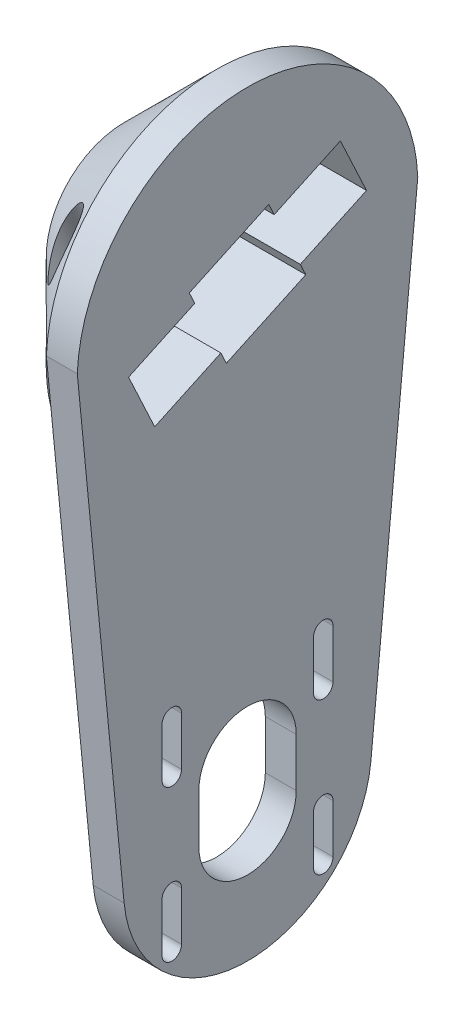
from build123d import *

# Parameters (mm, degrees)
BOSS_EXTRUDE1_DEPTH = 6.35
SKETCH20_R          = 35
BOSS_EXTRUDE5_DEPTH = 19.05
CUT_EXTRUDE14_DEPTH = 128.996314535
CHAMFER1_SIZE       = 19.05
SKETCH22_R          = 3.175
CUT_EXTRUDE15_DEPTH = 135.156064825
SKETCH24_R          = 5
CUT_EXTRUDE16_DEPTH = 140.018309755
SKETCH25_R          = 2.38125
CUT_EXTRUDE17_DEPTH = 10
CUT_EXTRUDE18_DEPTH = 10


with BuildPart() as part:
    # Sketch1 → Boss-Extrude1 (new body)
    with BuildSketch(Plane(origin=(0, 0, 0), x_dir=(0, 0, -1), z_dir=(1, 0, 0))):
        with BuildLine():
            Line((-34.968464441, 1.48542743), (-25.35, -97.464164516))
            ThreePointArc((-25.35, -97.464164516), (0, -120.469483831), (25.35, -97.464164516))
            Line((25.35, -97.464164516), (34.968464441, 1.48542743))
            ThreePointArc((34.968464441, 1.48542743), (0, 35), (-34.968464441, 1.48542743))
        make_face()
        Polygon((4.353205728, 11.960334439), (-11.960334439, 4.353205728), (-4.353205728, -11.960334439), (11.960334439, -4.353205728), align=None, mode=Mode.SUBTRACT)
    extrude(amount=BOSS_EXTRUDE1_DEPTH)

    # Sketch20 → Boss-Extrude5 (add)
    with BuildSketch(Plane(origin=(6.35, 0, 0), x_dir=(0, 0, -1), z_dir=(1, 0, 0))):
        with Locations(Location((0, 0, 0), (0, 0, 177.567591624))):
            Circle(SKETCH20_R)
    extrude(amount=BOSS_EXTRUDE5_DEPTH)

    # Sketch21 → Cut-Extrude14 (cut, through all)
    with BuildSketch(Plane.ZY):
        Polygon((-19.067760927, 15.897892729), (-24.435012851, 4.387783834), (-10.840396045, -1.951490092), (-5.473144121, 9.558618803), align=None)
        Polygon((-11.960334439, -4.353205728), (-4.353205728, 11.960334439), (11.960334439, 4.353205728), (4.353205728, -11.960334439), align=None)
        Polygon((10.840396045, 1.951490092), (5.473144121, -9.558618803), (19.067760927, -15.897892729), (24.435012851, -4.387783834), align=None)
    extrude(amount=-CUT_EXTRUDE14_DEPTH, mode=Mode.SUBTRACT)

    # Chamfer1
    # the kernel refuses this chamfer: 19.05 mm, written as the material it takes off along each edge
    with BuildSketch(Plane(origin=(25.4, 0, 0), x_dir=(0, 0.042440783710504346, 0.9990989840241247), z_dir=(0, 0.9990989840241247, -0.042440783710504346))) as chamfer1_piece_1:
        Polygon((35, -CHAMFER1_SIZE), (35 - CHAMFER1_SIZE, 0), (35, 0), align=None)
    revolve(axis=Axis((25.4, 0, 0), (1, 0, 0)), mode=Mode.SUBTRACT)

    # Sketch22 → Cut-Extrude15 (cut, through all)
    with BuildSketch(Plane(origin=(0, 5.755054448, 2.683625962), x_dir=(-1, 0, 0), z_dir=(0, -0.9063077870366495, -0.4226182617407006))):
        with Locations(Location((-13.4, -16.5, 0), (0, 0, 90))):
            Circle(SKETCH22_R)
    cut_extrude15 = extrude(amount=-CUT_EXTRUDE15_DEPTH, mode=Mode.SUBTRACT)

    # Sketch24 → Cut-Extrude16 (cut, through all)
    with BuildSketch(Plane(origin=(0, 10.286593383, 4.796717271), x_dir=(-1, 0, 0), z_dir=(0, -0.9063077870366495, -0.4226182617407006))):
        with Locations(Location((-13.4, -16.5, 0), (0, 0, 90))):
            Circle(SKETCH24_R)
    cut_extrude16 = extrude(amount=-CUT_EXTRUDE16_DEPTH, mode=Mode.SUBTRACT)

    # Sketch25 → Cut-Extrude17 (cut)
    with BuildSketch(Plane(origin=(0, -5.755054448, -2.683625962), x_dir=(1, 0, 0), z_dir=(0, 0.9063077870366495, 0.4226182617407006))):
        with Locations(Location((13.4, -16.5, 0), (0, 0, 270))):
            Circle(SKETCH25_R)
    cut_extrude17 = extrude(amount=-CUT_EXTRUDE17_DEPTH, mode=Mode.SUBTRACT)

    # Mirror1: Cut-Extrude15, Cut-Extrude16, Cut-Extrude17 across plane
    add(cut_extrude15.mirror(Plane(origin=(0, 0, 0), x_dir=(1, 0, 0), z_dir=(0, 0.42261826174070105, -0.9063077870366493))), mode=Mode.SUBTRACT)
    add(cut_extrude16.mirror(Plane(origin=(0, 0, 0), x_dir=(1, 0, 0), z_dir=(0, 0.42261826174070105, -0.9063077870366493))), mode=Mode.SUBTRACT)
    add(cut_extrude17.mirror(Plane(origin=(0, 0, 0), x_dir=(1, 0, 0), z_dir=(0, 0.42261826174070105, -0.9063077870366493))), mode=Mode.SUBTRACT)

    # Sketch19 → Cut-Extrude18 (cut)
    with BuildSketch(Plane(origin=(6.35, 0, 0), x_dir=(0, 0, -1), z_dir=(1, 0, 0))):
        with BuildLine():
            Line((13.556349186, -69.583650814), (13.556349186, -79.583650814))
            ThreePointArc((13.556349186, -79.583650814), (15.556349186, -81.583650814), (17.556349186, -79.583650814))
            Line((17.556349186, -79.583650814), (17.556349186, -69.583650814))
            ThreePointArc((17.556349186, -69.583650814), (15.556349186, -67.583650814), (13.556349186, -69.583650814))
        make_face()
        with BuildLine():
            Line((-10, -85.14), (-10, -95.14))
            ThreePointArc((-10, -95.14), (0, -105.14), (10, -95.14))
            Line((10, -95.14), (10, -85.14))
            ThreePointArc((10, -85.14), (0, -75.14), (-10, -85.14))
        make_face()
        with BuildLine():
            Line((17.556349186, -110.696349186), (17.556349186, -100.696349186))
            ThreePointArc((17.556349186, -100.696349186), (15.556349186, -98.696349186), (13.556349186, -100.696349186))
            Line((13.556349186, -100.696349186), (13.556349186, -110.696349186))
            ThreePointArc((13.556349186, -110.696349186), (15.556349186, -112.696349186), (17.556349186, -110.696349186))
        make_face()
        with BuildLine():
            Line((-17.556349186, -69.583650814), (-17.556349186, -79.583650814))
            ThreePointArc((-17.556349186, -79.583650814), (-15.556349186, -81.583650814), (-13.556349186, -79.583650814))
            Line((-13.556349186, -79.583650814), (-13.556349186, -69.583650814))
            ThreePointArc((-13.556349186, -69.583650814), (-15.556349186, -67.583650814), (-17.556349186, -69.583650814))
        make_face()
        with BuildLine():
            Line((-13.556349186, -110.696349186), (-13.556349186, -100.696349186))
            ThreePointArc((-13.556349186, -100.696349186), (-15.556349186, -98.696349186), (-17.556349186, -100.696349186))
            Line((-17.556349186, -100.696349186), (-17.556349186, -110.696349186))
            ThreePointArc((-17.556349186, -110.696349186), (-15.556349186, -112.696349186), (-13.556349186, -110.696349186))
        make_face()
    extrude(amount=-CUT_EXTRUDE18_DEPTH, mode=Mode.SUBTRACT)


with BuildPart() as body_2:
    # Mirror2: mirrored copy
    add(part.part.mirror(Plane(origin=(0, 0, 0), x_dir=(0, 0, 1), z_dir=(1, 0, 0))))


solid = body_2.part
